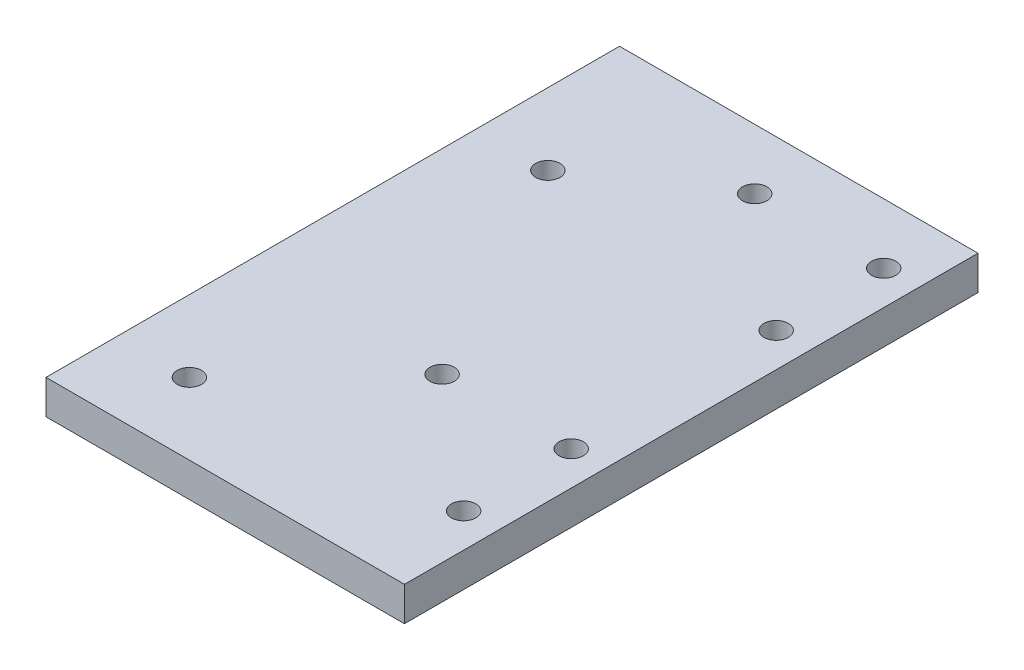
from build123d import *

# Parameters (mm, degrees)
SKETCH1_R           = 1.7
BOSS_EXTRUDE1_DEPTH = 4.7625


with BuildPart() as part:
    # Sketch1 → Boss-Extrude1 (new body)
    with BuildSketch(Plane(origin=(0, 0, 0), x_dir=(1, 0, 0), z_dir=(0, 1, 0))):
        Polygon((0, 90), (0, 10), (20, 10), (50, 10), (50, 90), align=None)
        with Locations((10, 20)):
            Circle(SKETCH1_R, mode=Mode.SUBTRACT)
        with Locations((27.25, 38)):
            Circle(SKETCH1_R, mode=Mode.SUBTRACT)
        with Locations((45.25, 23)):
            Circle(SKETCH1_R, mode=Mode.SUBTRACT)
        with Locations((45.25, 38)):
            Circle(SKETCH1_R, mode=Mode.SUBTRACT)
        with Locations((10, 70)):
            Circle(SKETCH1_R, mode=Mode.SUBTRACT)
        with Locations((45.25, 66.6)):
            Circle(SKETCH1_R, mode=Mode.SUBTRACT)
        with Locations((27.25, 81.6)):
            Circle(SKETCH1_R, mode=Mode.SUBTRACT)
        with Locations((45.25, 81.6)):
            Circle(SKETCH1_R, mode=Mode.SUBTRACT)
    extrude(amount=BOSS_EXTRUDE1_DEPTH)


solid = part.part
